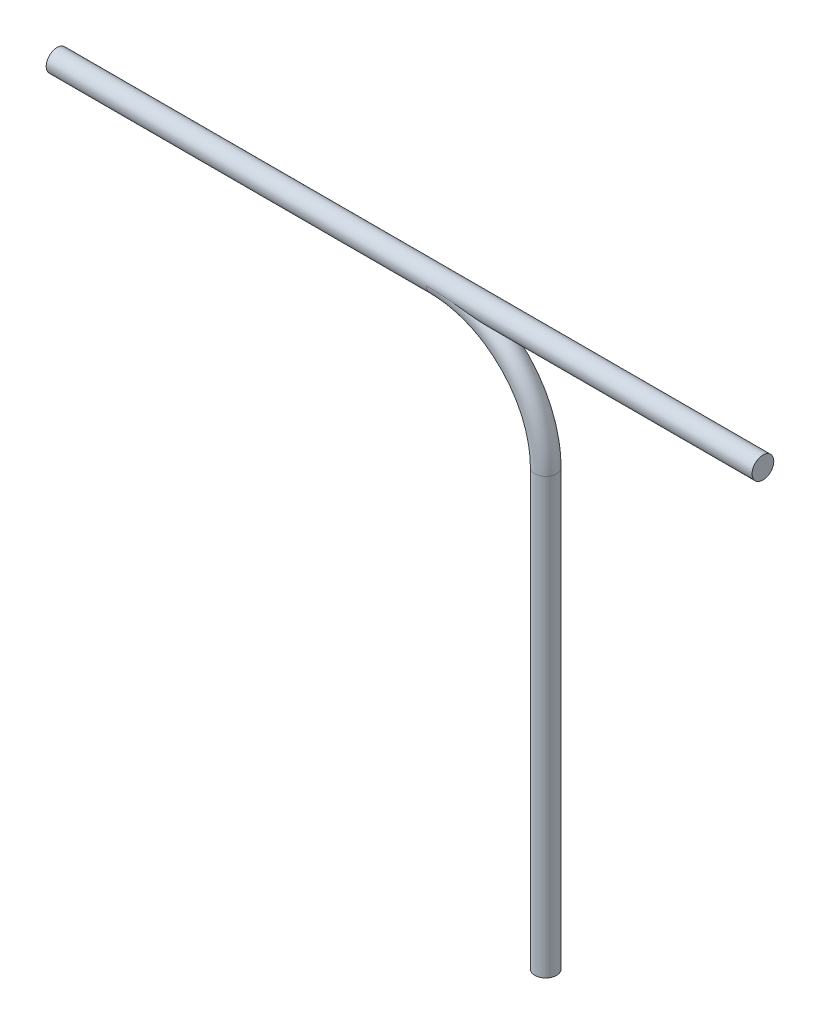
from build123d import *

# Parameters (mm, degrees)
SKETCH_3_R        = 1
SWEEP_START       = 35
SWEEP_6_OUTLINE_R = 1
SWEEP_6_DEPTH     = 30


# Read off the part's stored shape, not the designer's step: ｽｲｰﾌﾟ6
with BuildPart() as part:
    # ｽｲｰﾌﾟ3: sweep along a path in ｽｹｯﾁ4
    with BuildLine(Plane.XY) as sweep_3_path:
        Line((0, 0), (34.999999999999936, 0))
        ThreePointArc((34.999999999999936, 0), (42.071067811865476, -2.9289321881345254), (45, -10.000000000000066))
        Line((45, -10.000000000000066), (45.000000000000014, -50))
    # ｽｹｯﾁ3 → ｽｲｰﾌﾟ3 (sweep)
    with BuildSketch(Plane(origin=(0, 0, 0), x_dir=(0, 0, -1), z_dir=(1, 0, 0))):
        Circle(SKETCH_3_R)
    sweep(path=sweep_3_path.line)

    # ｽｲｰﾌﾟ6 outline → ｽｲｰﾌﾟ6 (add)
    with BuildSketch(Plane.YZ.offset(SWEEP_START)):
        Circle(SWEEP_6_OUTLINE_R)
    extrude(amount=SWEEP_6_DEPTH)


solid = part.part
